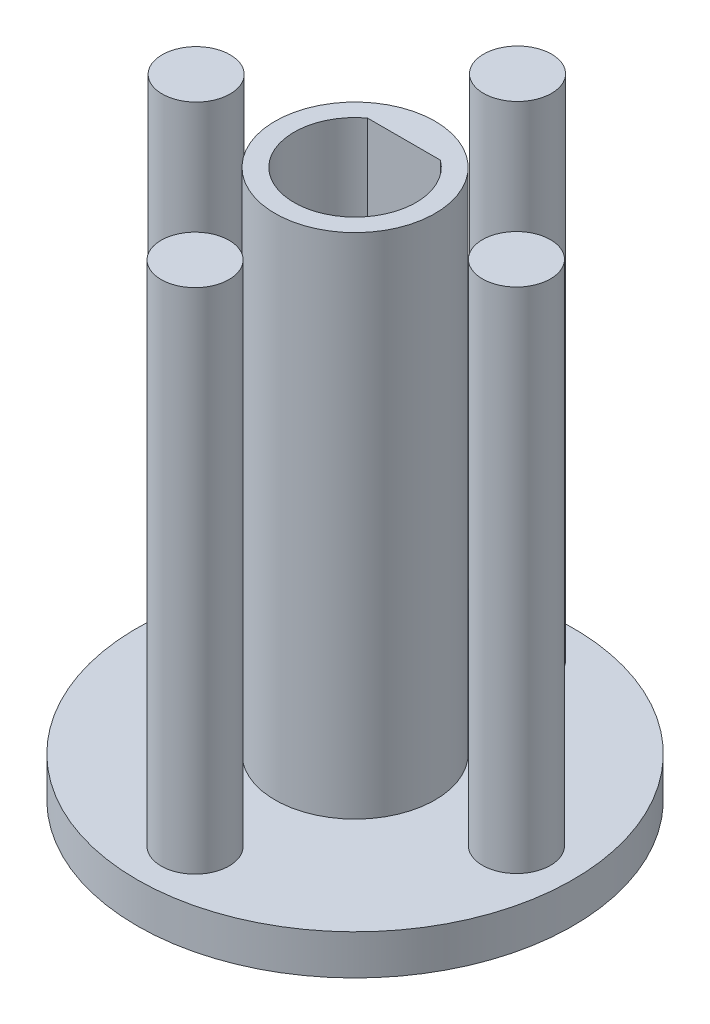
from build123d import *

# Parameters (mm, degrees)
SKETCH3_R             = 1.7
BOSS_EXTRUDE1_DEPTH   = 27.4
BOSS_EXTRUDE1_2_DEPTH = 27.4
BOSS_EXTRUDE1_3_DEPTH = 27.4
BOSS_EXTRUDE1_4_DEPTH = 27.4
SKETCH3_R_2           = 4
BOSS_EXTRUDE1_5_DEPTH = 27.4
SKETCH3_17_R          = 10.9
BOSS_EXTRUDE2_DEPTH   = 2


with BuildPart() as part:
    # Sketch3 → Boss-Extrude1 (new body)
    with BuildSketch(Plane(origin=(0, 0, 0), x_dir=(1, 0, 0), z_dir=(0, 1, 0))):
        with Locations((0.009034474, 8.115584077)):
            Circle(SKETCH3_R)
    extrude(amount=BOSS_EXTRUDE1_DEPTH)



with BuildPart() as body_2:
    # Sketch3 → Boss-Extrude1 2 (new body)
    with BuildSketch(Plane(origin=(0, 0, 0), x_dir=(1, 0, 0), z_dir=(0, 1, 0))):
        with Locations((8.017679827, 0.053335715)):
            Circle(SKETCH3_R)
    extrude(amount=BOSS_EXTRUDE1_2_DEPTH)


with BuildPart() as body_3:
    # Sketch3 → Boss-Extrude1 3 (new body)
    with BuildSketch(Plane(origin=(0, 0, 0), x_dir=(1, 0, 0), z_dir=(0, 1, 0))):
        with Locations((0.009179949, -8.009057152)):
            Circle(SKETCH3_R)
    extrude(amount=BOSS_EXTRUDE1_3_DEPTH)


with BuildPart() as body_4:
    # Sketch3 → Boss-Extrude1 4 (new body)
    with BuildSketch(Plane(origin=(0, 0, 0), x_dir=(1, 0, 0), z_dir=(0, 1, 0))):
        with Locations((-7.999465404, 0.05319121)):
            Circle(SKETCH3_R)
    extrude(amount=BOSS_EXTRUDE1_4_DEPTH)


with BuildPart() as body_5:
    # Sketch3 → Boss-Extrude1 5 (new body)
    with BuildSketch(Plane(origin=(0, 0, 0), x_dir=(1, 0, 0), z_dir=(0, 1, 0))):
        Circle(SKETCH3_R_2)
        with BuildLine():
            Line((-1.823098343, 2.445161023), (1.823098343, 2.445161023))
            ThreePointArc((1.823098343, 2.445161023), (0, -3.05), (-1.823098343, 2.445161023))
        make_face(mode=Mode.SUBTRACT)
    extrude(amount=BOSS_EXTRUDE1_5_DEPTH)


with BuildPart() as part_1:
    add(part.part)

    add(body_2.part)  # Boss-Extrude2 merges body 2

    add(body_3.part)  # Boss-Extrude2 merges body 3

    add(body_4.part)  # Boss-Extrude2 merges body 4

    add(body_5.part)  # Boss-Extrude2 merges body 5
    # Sketch3<17> → Boss-Extrude2 (add)
    with BuildSketch(Plane(origin=(0, 0, 0), x_dir=(1, 0, 0), z_dir=(0, 1, 0))):
        Circle(SKETCH3_17_R)
    extrude(amount=BOSS_EXTRUDE2_DEPTH)


solid = part_1.part
